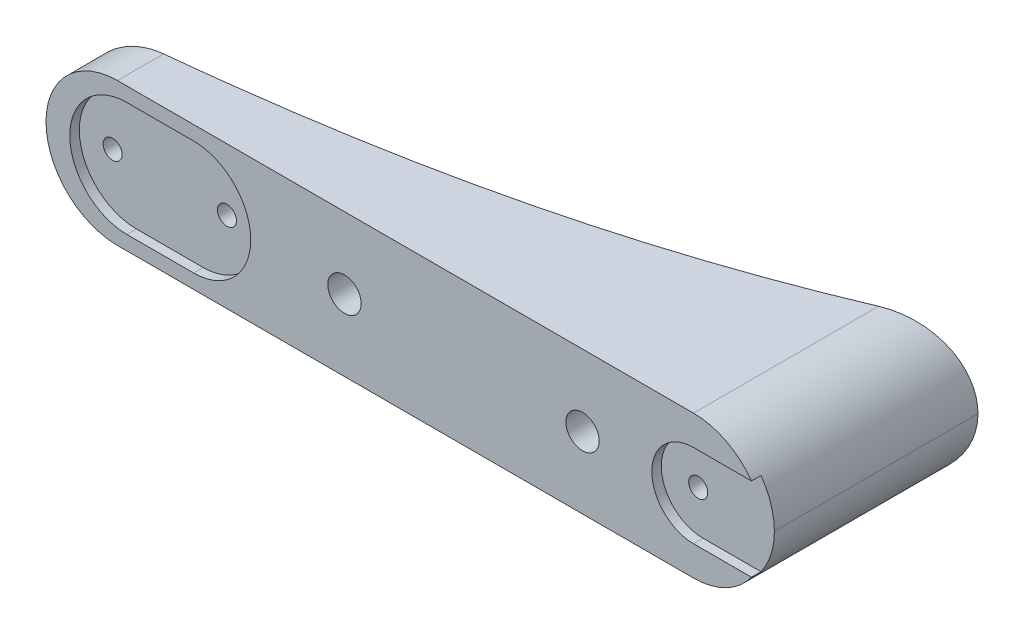
from build123d import *
from build123d.topology import SkipClean

# Parameters (mm, degrees)
BOSS_EXTRUDE1_DEPTH      = 30
SKETCH10_W               = 151
SKETCH10_H               = 30
BOSS_EXTRUDE2_DEPTH      = 40
SKETCH2_R                = 2
CUT_EXTRUDE1_DEPTH       = 94.198193522
SKETCH2_6_R              = 2
CUT_EXTRUDE2_DEPTH       = 2
SKETCH2_7_R              = 2
CUT_EXTRUDE3_DEPTH       = 2
F_7_0_7_DIAMETER_HOLE1_D = 7
CUT_EXTRUDE5_START       = 5
SKETCH9_R                = 3.5
CUT_EXTRUDE5_DEPTH       = 89.198193522
FILLET1_R                = 15


with BuildPart() as part:
    # Sketch1 → Boss-Extrude1 (new body)
    with BuildSketch(Plane(origin=(0, 0, 0), x_dir=(1, 0, 0), z_dir=(0, 1, 0))):
        Polygon((-25.3, 7), (49.7, 7), (75.5, 7), (75.5, 0), (-75.5, 0), (-75.5, 7), align=None)
    extrude(amount=BOSS_EXTRUDE1_DEPTH)

    # Sketch10 → Boss-Extrude2 (add)
    with BuildSketch(Plane(origin=(0, 0, -7), x_dir=(-1, 0, 0), z_dir=(0, 0, -1))):
        with Locations((0, 15)):
            Rectangle(SKETCH10_W, SKETCH10_H)
    extrude(amount=BOSS_EXTRUDE2_DEPTH)

    # Sketch13 → Cut-Revolve1 (revolve, cut)
    with SkipClean():  # the faces are left unmerged after this step: merging them gives an invalid solid
        with BuildSketch(Plane(origin=(0, 15, 0), x_dir=(1, 0, 0), z_dir=(0, 1, 0))):
            with BuildLine():
                Line((213.057276424, 147.5), (-103.5, 147.5))
                Line((-103.5, 147.5), (-103.5, 5.807423347))
                add(Edge.make_bspline(
                    [(-103.5, 5.807423347), (-21.17006382, 9.777706594), (50.172186829, 25.996032335), (136.844602336, 80.345696305), (186.549339742, 122.894371989), (213.057276424, 147.5)],
                    knots=[0, 0, 0, 0, 0.647236276, 0.769471995, 1, 1, 1, 1], degree=3))
            make_face()
        revolve(axis=Axis((213.057276424, 15, -170), (-1, 0, 0)), mode=Mode.SUBTRACT)
    add(part.part.scale(1), mode=Mode.REPLACE)  # the faces are merged on a copy

    # Sketch2 → Cut-Extrude1 (cut, through all)
    with BuildSketch(Plane.XY):
        with Locations((-39.5, 15)):
            Circle(SKETCH2_R)
        with Locations((59.5, 15)):
            Circle(SKETCH2_R)
        with Locations((-63.5, 15)):
            Circle(SKETCH2_R)
    extrude(amount=-CUT_EXTRUDE1_DEPTH, mode=Mode.SUBTRACT)

    # Sketch2<6> → Cut-Extrude2 (cut)
    with BuildSketch(Plane.XY):
        with BuildLine():
            Line((-58.5, 3), (-44.5, 3))
            ThreePointArc((-44.5, 3), (-32.5, 15), (-44.5, 27))
            Line((-44.5, 27), (-58.5, 27))
            ThreePointArc((-58.5, 27), (-70.5, 15), (-58.5, 3))
        make_face()
        with Locations((-39.5, 15)):
            Circle(SKETCH2_6_R, mode=Mode.SUBTRACT)
        with Locations((-63.5, 15)):
            Circle(SKETCH2_6_R, mode=Mode.SUBTRACT)
    extrude(amount=-CUT_EXTRUDE2_DEPTH, mode=Mode.SUBTRACT)

    # Sketch2<7> → Cut-Extrude3 (cut)
    # profile 1 of 2: a face of its own
    with BuildSketch(Plane.XY):
        with BuildLine():
            Line((60.5, 23.75), (75.5, 23.75))
            Line((75.5, 23.75), (75.5, 6.25))
            Line((75.5, 6.25), (60.5, 6.25))
            ThreePointArc((60.5, 6.25), (51.75, 15), (60.5, 23.75))
        make_face()
        with Locations((59.5, 15)):
            Circle(SKETCH2_7_R, mode=Mode.SUBTRACT)
    # profile 2 of 2: a face of its own
    with BuildSketch(Plane.XY):
        with BuildLine():
            Line((-58.5, 27), (-44.5, 27))
            ThreePointArc((-44.5, 27), (-32.5, 15), (-44.5, 3))
            Line((-44.5, 3), (-58.5, 3))
            ThreePointArc((-58.5, 3), (-70.5, 15), (-58.5, 27))
        make_face()
        with Locations((-63.5, 15)):
            Circle(SKETCH2_7_R, mode=Mode.SUBTRACT)
        with Locations((-39.5, 15)):
            Circle(SKETCH2_7_R, mode=Mode.SUBTRACT)
    extrude(amount=-CUT_EXTRUDE3_DEPTH, mode=Mode.SUBTRACT)

    # Ø7.0 (7) Diameter Hole1 (through all)
    with Locations(Plane(origin=(0, 0, 0), x_dir=(-1, 0, 0), z_dir=(0, 0, 1))):
        with Locations((-37.2, -15), (12.8, -15)):
            Hole(F_7_0_7_DIAMETER_HOLE1_D / 2)

    # Sketch9 → Cut-Extrude5 (cut, through all)
    with BuildSketch(Plane(origin=(0, 0, 0), x_dir=(-1, 0, 0), z_dir=(0, 0, -1)).offset(CUT_EXTRUDE5_START)):
        with Locations(Location((-59.5, 15, 0), (0, 0, 180))):
            Circle(SKETCH9_R)
        with Locations(Location((39.5, 15, 0), (0, 0, 180))):
            Circle(SKETCH9_R)
        with Locations(Location((63.5, 15, 0), (0, 0, 180))):
            Circle(SKETCH9_R)
    extrude(amount=CUT_EXTRUDE5_DEPTH, mode=Mode.SUBTRACT)

    # Fillet1
    fillet1_edges = [part.edges().sort_by_distance(p)[0] for p in [
        (75.5, 30, -22.834476377),
        (-75.5, 0, -4.152504649),
        (75.5, 0, -22.834476377),
        (-75.5, 30, -4.152504649),
    ]]
    fillet(fillet1_edges, radius=FILLET1_R - 0.0001)  # a hair under: the kernel refuses the full size


solid = part.part
